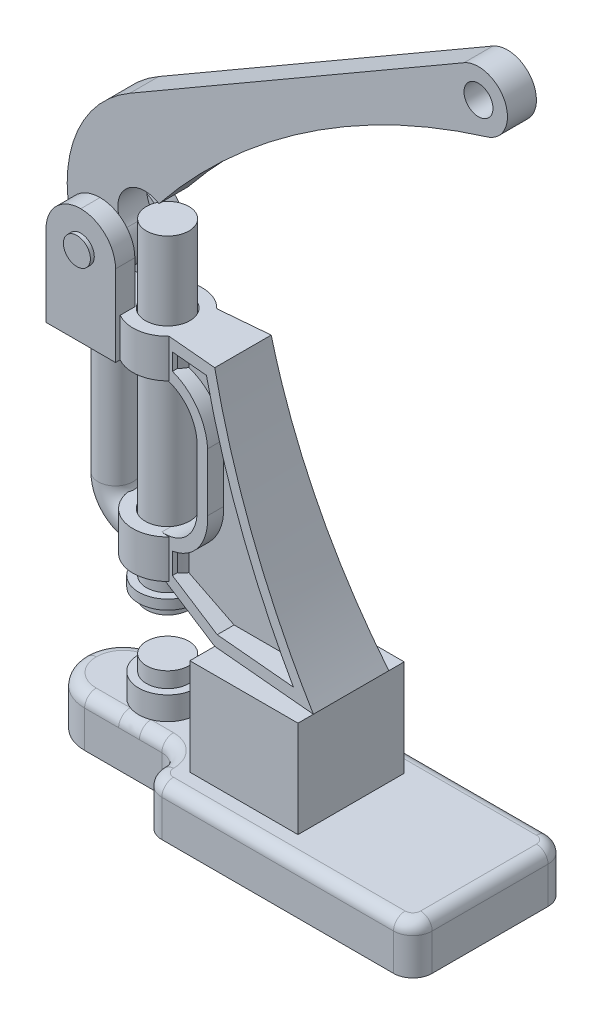
from build123d import *

# Parameters (mm, degrees)
BOSS_EXTRUDE1_DEPTH            = 25
SKETCH3_W                      = 56
SKETCH3_H                      = 55
BOSS_EXTRUDE2_DEPTH            = 50
BOSS_EXTRUDE4_DEPTH            = 12
CUT_EXTRUDE1_DEPTH             = 6
DRAFT1_ANGLE                   = 5
SKETCH8_R                      = 18
BOSS_EXTRUDE5_DEPTH            = 20
BOSS_EXTRUDE6_START            = -90
SKETCH8_2_R                    = 18
BOSS_EXTRUDE6_DEPTH            = 20
SKETCH9_W                      = 36
SKETCH9_H                      = 36
BOSS_EXTRUDE7_DEPTH            = 20
SKETCH10_W                     = 36
SKETCH10_H                     = 10
BOSS_EXTRUDE8_DEPTH            = 40
F_22_0_22_DIAMETER_HOLE1_D     = 22
F_22_0_22_DIAMETER_HOLE1_DEPTH = 125
F_22_0_22_DIAMETER_HOLE1_TIP   = 6.609466809
F_14_0_14_DIAMETER_HOLE1_D     = 14
BOSS_EXTRUDE10_DEPTH           = 40
BOSS_EXTRUDE10_DEPTH_BACK      = 130
SKETCH20_R                     = 11
SKETCH21_R                     = 7
SKETCH21_R_2                   = 7.5
BOSS_EXTRUDE11_DEPTH           = 7.5
SKETCH22_R                     = 15
BOSS_EXTRUDE12_DEPTH           = 12
SKETCH24_R                     = 11
BOSS_EXTRUDE13_DEPTH           = 8
BOSS_EXTRUDE14_START           = 2
SKETCH25_R                     = 7
BOSS_EXTRUDE14_DEPTH           = 40
SKETCH44_R                     = 9
FILLET1_R                      = 20
FILLET2_R                      = 18
FILLET3_R                      = 10
FILLET4_R                      = 6
SKETCH45_R                     = 11.5
CUT_EXTRUDE2_DEPTH             = 123
BOSS_EXTRUDE15_START           = -5
SKETCH46_R                     = 15
BOSS_EXTRUDE15_DEPTH           = 5


with BuildPart() as part:
    # Sketch1 → Boss-Extrude1 (new body)
    with BuildSketch(Plane(origin=(0, 0, 0), x_dir=(1, 0, 0), z_dir=(0, 1, 0))):
        Polygon((-35, 20), (-105, 20), (-105, -20), (-35, -20), (-35, -40), (105, -40), (105, 40), (-35, 40), align=None)
    extrude(amount=BOSS_EXTRUDE1_DEPTH)

    # Sketch3 → Boss-Extrude2 (add)
    with BuildSketch(Plane(origin=(0, 25, 0), x_dir=(1, 0, 0), z_dir=(0, 1, 0))):
        with Locations((5, 0)):
            Rectangle(SKETCH3_W, SKETCH3_H)
    extrude(amount=BOSS_EXTRUDE2_DEPTH)

    # Sketch6 → Boss-Extrude4 (add, symmetric)
    with BuildSketch(Plane.XY):
        with BuildLine():
            Line((-23, 200), (-53, 200))
            Line((-53, 200), (-53, 180))
            ThreePointArc((-53, 180), (-39.295873551, 174.56698041), (-33.037225848, 161.219691828))
            Line((-33.037225848, 161.219691828), (-33.037225848, 131.219691828))
            ThreePointArc((-33.037225848, 131.219691828), (-38.43301959, 116.295873551), (-53, 110))
            Line((-53, 110), (-53, 90))
            Line((-53, 90), (-23, 75))
            Line((-23, 75), (33, 75))
            ThreePointArc((33, 75), (-0.999695953, 134.812136213), (-23, 200))
        make_face()
    extrude(amount=BOSS_EXTRUDE4_DEPTH, both=True)

    # Sketch7 → Cut-Extrude1 (cut)
    with BuildSketch(Plane.XY.offset(12)):
        with BuildLine():
            Line((-21.583592135, 81), (21.667755139, 81))
            ThreePointArc((21.667755139, 81), (-7.823110245, 135.404591087), (-27.726595535, 194))
            Line((-27.726595535, 194), (-47, 194))
            Line((-47, 194), (-47, 185.298221281))
            ThreePointArc((-47, 185.298221281), (-33.042650823, 176.664459602), (-27.037225848, 161.390812112))
            Line((-27.037225848, 161.390812112), (-27.037225848, 131.390812112))
            ThreePointArc((-27.037225848, 131.390812112), (-32.179796861, 114.426973921), (-47, 104.701778719))
            Line((-47, 104.701778719), (-47, 93.708203932))
            Line((-47, 93.708203932), (-21.583592135, 81))
        make_face()
    cut_extrude1 = extrude(amount=-CUT_EXTRUDE1_DEPTH, mode=Mode.SUBTRACT)

    # Mirror2: Cut-Extrude1 across plane
    add(cut_extrude1.mirror(Plane.XY), mode=Mode.SUBTRACT)

    # Draft1
    draft1_faces = [part.faces().sort_by_distance(p)[0] for p in [
        (-38, 198.48273272, -12),
        (-38, 198.48273272, 12),
    ]]
    draft(draft1_faces, Plane(origin=(-53, 200, 12), x_dir=(0, 0, -1), z_dir=(-1, 0, 0)), DRAFT1_ANGLE)

    # Sketch8 → Boss-Extrude5 (add)
    with BuildSketch(Plane(origin=(0, 200, 0), x_dir=(1, 0, 0), z_dir=(0, 1, 0))):
        with Locations((-62, 0)):
            Circle(SKETCH8_R)
    extrude(amount=-BOSS_EXTRUDE5_DEPTH)

    # Sketch8<2> → Boss-Extrude6 (add)
    with BuildSketch(Plane(origin=(0, 200, 0), x_dir=(1, 0, 0), z_dir=(0, 1, 0)).offset(BOSS_EXTRUDE6_START)):
        with Locations((-62, 0)):
            Circle(SKETCH8_2_R)
    extrude(amount=-BOSS_EXTRUDE6_DEPTH)

    # Sketch9 → Boss-Extrude7 (add)
    with BuildSketch(Plane(origin=(0, 200, 0), x_dir=(1, 0, 0), z_dir=(0, 1, 0))):
        with Locations((-89, 0)):
            Rectangle(SKETCH9_W, SKETCH9_H)
    extrude(amount=-BOSS_EXTRUDE7_DEPTH)

    # Sketch10 → Boss-Extrude8 (add)
    with BuildSketch(Plane(origin=(0, 200, 0), x_dir=(1, 0, 0), z_dir=(0, 1, 0))):
        with Locations((-89, 13)):
            Rectangle(SKETCH10_W, SKETCH10_H)
        with Locations((-89, -13)):
            Rectangle(SKETCH10_W, SKETCH10_H)
    extrude(amount=BOSS_EXTRUDE8_DEPTH)

    # Ø22.0 (22) Diameter Hole1
    with Locations(Plane(origin=(0, 200, 0), x_dir=(1, 0, 0), z_dir=(0, 1, 0))):
        with Locations((-62, 0)):
            Hole(F_22_0_22_DIAMETER_HOLE1_D / 2, depth=F_22_0_22_DIAMETER_HOLE1_DEPTH)
            with Locations((0, 0, -(F_22_0_22_DIAMETER_HOLE1_DEPTH + F_22_0_22_DIAMETER_HOLE1_TIP / 2))):  # 118° drill point
                Cone(0, F_22_0_22_DIAMETER_HOLE1_D / 2, F_22_0_22_DIAMETER_HOLE1_TIP, mode=Mode.SUBTRACT)

    # Ø14.0 (14) Diameter Hole1 (through all)
    with Locations(Plane.XY.offset(18)):
        with Locations((-89, 222)):
            Hole(F_14_0_14_DIAMETER_HOLE1_D / 2)

    # Sketch22 → Boss-Extrude12 (add)
    with BuildSketch(Plane(origin=(0, 25, 0), x_dir=(1, 0, 0), z_dir=(0, 1, 0))):
        with Locations(Location((-62, 0, 0), (0, 0, 270))):
            Circle(SKETCH22_R)
    extrude(amount=BOSS_EXTRUDE12_DEPTH)

    # Sketch24 → Boss-Extrude13 (add)
    with BuildSketch(Plane(origin=(0, 37, 0), x_dir=(1, 0, 0), z_dir=(0, 1, 0))):
        with Locations(Location((-62, 0, 0), (0, 0, 270))):
            Circle(SKETCH24_R)
    extrude(amount=BOSS_EXTRUDE13_DEPTH)

    # Sweep1: sweep along a path in Sketch26
    with BuildLine(Plane.XY) as sweep1_path:
        Line((-89, 180), (-89, 113))
        ThreePointArc((-89, 113), (-84.606601718, 102.393398282), (-74, 98))
        Line((-74, 98), (-73.9, 98))
    # Sketch44 → Sweep1 (sweep)
    with BuildSketch(Plane.XZ.offset(-180)):
        with Locations((-89, 0)):
            Circle(SKETCH44_R)
    sweep(path=sweep1_path.line)

    # Fillet1
    fillet1_edges = [part.edges().sort_by_distance(p)[0] for p in [
        (-105, 12.5, -20),
        (-105, 12.5, 20),
    ]]
    fillet(fillet1_edges, radius=FILLET1_R - 0.0001)  # a hair under: the kernel refuses the full size

    # Fillet2
    fillet2_edges = [part.edges().sort_by_distance(p)[0] for p in [
        (-71, 240, 13),
        (-107, 240, 13),
        (-71, 240, -13),
        (-107, 240, -13),
    ]]
    fillet(fillet2_edges, radius=FILLET2_R - 0.0001)  # a hair under: the kernel refuses the full size

    # Fillet3
    fillet3_edges = [part.edges().sort_by_distance(p)[0] for p in [
        (-35, 12.5, -20),
        (-35, 12.5, -40),
        (105, 12.5, -40),
        (105, 12.5, 40),
        (-35, 12.5, 40),
        (-35, 12.5, 20),
    ]]
    fillet(fillet3_edges, radius=FILLET3_R - 0.0001)  # a hair under: the kernel refuses the full size

    # Fillet4
    fillet4_edges = [part.edges().sort_by_distance(p)[0] for p in [
        (-65, 25, 20),
        (-99.142164913, 25, 14.142164913),
        (-99.142164913, 25, -14.142164913),
        (-65, 25, -20),
        (35, 25, -40),
        (35, 25, 40),
        (105, 25, 0),
        (-32.071097101, 25, 37.071097101),
        (102.071097101, 25, 37.071097101),
        (102.071097101, 25, -37.071097101),
        (-32.071097101, 25, -37.071097101),
        (-37.928902899, 25, -22.928902899),
        (-37.928902899, 25, 22.928902899),
    ]]
    fillet(fillet4_edges, radius=FILLET4_R)

    # Sketch45 → Cut-Extrude2 (cut)
    with BuildSketch(Plane(origin=(0, 200, 0), x_dir=(1, 0, 0), z_dir=(0, 1, 0))):
        with Locations(Location((-62, 0, 0), (0, 0, 321.500049591))):
            Circle(SKETCH45_R)
    extrude(amount=-CUT_EXTRUDE2_DEPTH, mode=Mode.SUBTRACT)


with BuildPart() as body_2:
    # Sketch20 → Boss-Extrude10 (new, two sides: drawn at the far end of the back side and taken through both)
    with BuildSketch(Plane(origin=(0, 200, 0), x_dir=(1, 0, 0), z_dir=(0, 1, 0)).offset(-BOSS_EXTRUDE10_DEPTH_BACK)):
        with Locations(Location((-62, 0, 0), (0, 0, 270))):
            Circle(SKETCH20_R)
    extrude(amount=BOSS_EXTRUDE10_DEPTH + BOSS_EXTRUDE10_DEPTH_BACK)

    # Sketch46 → Boss-Extrude15 (add)
    with BuildSketch(Plane.XZ.offset(-70).offset(BOSS_EXTRUDE15_START)):
        with Locations(Location((-62, 0, 0), (0, 0, 270))):
            Circle(SKETCH46_R)
    extrude(amount=-BOSS_EXTRUDE15_DEPTH)


with BuildPart() as body_3:
    # Sketch21 → Boss-Extrude11 (new, symmetric)
    with BuildSketch(Plane.XY):
        with BuildLine():
            Line((-74.10993348, 293.981573913), (98.96909267, 394.199589793))
            ThreePointArc((98.96909267, 394.199589793), (120.326980446, 386.998962561), (110.433237586, 366.747487182))
            ThreePointArc((110.433237586, 366.747487182), (17.143252803, 322.032958989), (-59, 252))
            ThreePointArc((-59, 252), (-76.798733968, 249.332819383), (-77.263776346, 231.341362553))
            ThreePointArc((-77.263776346, 231.341362553), (-81.859244168, 208.808729926), (-103.238276504, 217.280732876))
            ThreePointArc((-103.238276504, 217.280732876), (-102.304738798, 260.807599594), (-74.10993348, 293.981573913))
        make_face()
        with Locations((-89, 222)):
            Circle(SKETCH21_R, mode=Mode.SUBTRACT)
        with Locations((106.485443861, 381.218662832)):
            Circle(SKETCH21_R_2, mode=Mode.SUBTRACT)
    extrude(amount=BOSS_EXTRUDE11_DEPTH, both=True)


with BuildPart() as body_4:
    # Sketch25 → Boss-Extrude14 (new body)
    with BuildSketch(Plane.XY.offset(18).offset(BOSS_EXTRUDE14_START)):
        with Locations((-89, 222)):
            Circle(SKETCH25_R)
    extrude(amount=-BOSS_EXTRUDE14_DEPTH)


solid = Compound([part.part, body_2.part, body_3.part, body_4.part])
